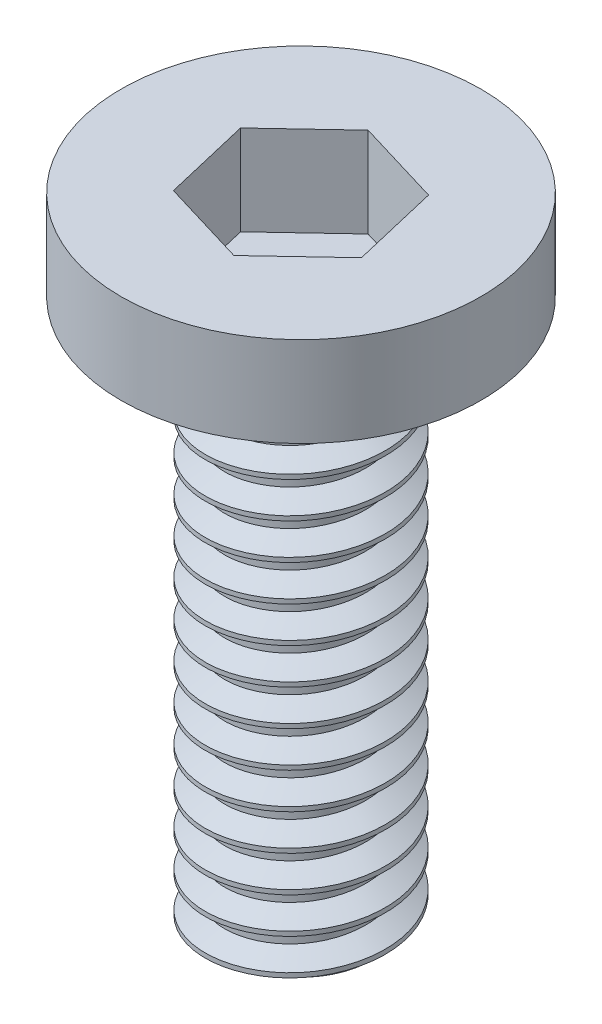
from build123d import *
from build123d.topology import SkipClean

# Parameters (mm, degrees)
SKIZZE1_R                       = 2
AUFSATZ_LINEAR_AUSTRAGEN1_DEPTH = 1
SKIZZE2_R                       = 1
AUFSATZ_LINEAR_AUSTRAGEN2_DEPTH = 6
GEWINDE1_PITCH                  = 0.4
AUFSATZ_LINEAR_AUSTRAGEN3_DEPTH = 1
SCHNITT_LINEAR_AUSTRAGEN1_DEPTH = 1


with BuildPart() as part:
    # Skizze1 → Aufsatz-Linear austragen1 (new body)
    with BuildSketch(Plane(origin=(0, 0, 0), x_dir=(1, 0, 0), z_dir=(0, 1, 0))):
        with Locations(Location((0, 0, 0), (0, 0, 270))):
            Circle(SKIZZE1_R)
    extrude(amount=AUFSATZ_LINEAR_AUSTRAGEN1_DEPTH)

    # Skizze2 → Aufsatz-Linear austragen2 (add)
    with BuildSketch(Plane.XZ):
        with Locations(Location((0, 0, 0), (0, 0, 270))):
            Circle(SKIZZE2_R)
    extrude(amount=AUFSATZ_LINEAR_AUSTRAGEN2_DEPTH)

    # Gewinde1: the profile of Gewindeprofil1 profile screwed along a right-hand helix of 15 turns, 6 arcs to a turn; built about Z, then put on its axis
    with SkipClean():  # the faces are left unmerged after this step: merging them gives an invalid solid
        gewinde1_z = Axis((0, 0, 0), (0, 0, 1))
        gewinde1_corners = [(1.0003, 0, -0.000173205), (1.0003, 0, 0.350173204), (0.78349365, 0, 0.224999999), (0.78349365, 0, 0.124999999)]
        with BuildLine(mode=Mode.PRIVATE) as gewinde1_profile:
            Line(gewinde1_corners[0], gewinde1_corners[1])
            Line(gewinde1_corners[1], gewinde1_corners[2])
            Line(gewinde1_corners[2], gewinde1_corners[3])
            Line(gewinde1_corners[3], gewinde1_corners[0])
        gewinde1_cap = Face(gewinde1_profile.wire())
        gewinde1_turn_angles = [0, 30, 60, 90, 120, 150, 180, 210, 240, 270, 300, 330, 360]
        gewinde1_turn_weights = [1, 0.8660254037844387, 1, 0.8660254037844387, 1, 0.8660254037844387, 1, 0.8660254037844387, 1, 0.8660254037844387, 1, 0.8660254037844387, 1]
        gewinde1_turn_rails = [Edge.make_bspline([Vector(p[0], p[1], 0).rotate(gewinde1_z, gewinde1_turn_angles[k]) / gewinde1_turn_weights[k] + Vector(0, 0, p[2] + GEWINDE1_PITCH * gewinde1_turn_angles[k] / 360) for k in range(13)], [0, 0, 0, 1, 1, 2, 2, 3, 3, 4, 4, 5, 5, 6, 6, 6], 2, gewinde1_turn_weights) for p in gewinde1_corners]
        gewinde1_turn_sides = [Face.make_surface_from_curves(gewinde1_turn_rails[p[0]], gewinde1_turn_rails[p[1]]) for p in [(0, 1), (1, 2), (2, 3), (3, 0)]]
        gewinde1 = Plane(origin=(0, 0, 0), x_dir=(-1, 0, 0), z_dir=(0, -1, 0)) * Solid(Shell([*[p.moved(Location((0, 0, GEWINDE1_PITCH * i))) for i in range(15) for p in gewinde1_turn_sides], gewinde1_cap, gewinde1_cap.rotate(gewinde1_z, 5400).moved(Location((0, 0, GEWINDE1_PITCH * 5400 / 360)))]))
        add(gewinde1, mode=Mode.SUBTRACT)

    # Skizze6 → Aufsatz-Linear austragen3 (add)
    with BuildSketch(Plane(origin=(0, 1, 0), x_dir=(1, 0, 0), z_dir=(0, 1, 0))):
        Polygon((0.8067354, 0.602693299), (-0.118580008, 1), (-0.925315408, 0.397306701), (-0.8067354, -0.602693299), (0.118580008, -1), (0.925315408, -0.397306701), align=None)
    extrude(amount=-AUFSATZ_LINEAR_AUSTRAGEN3_DEPTH)

    # Skizze8 → Schnitt-Linear austragen1 (cut)
    with BuildSketch(Plane(origin=(0, 1, 0), x_dir=(1, 0, 0), z_dir=(0, 1, 0))):
        Polygon((0.730468281, 0.687717332), (-0.230346539, 0.976462754), (-0.96081482, 0.288745422), (-0.730468281, -0.687717332), (0.230346539, -0.976462754), (0.96081482, -0.288745422), align=None)
    extrude(amount=-SCHNITT_LINEAR_AUSTRAGEN1_DEPTH, mode=Mode.SUBTRACT)


solid = part.part
